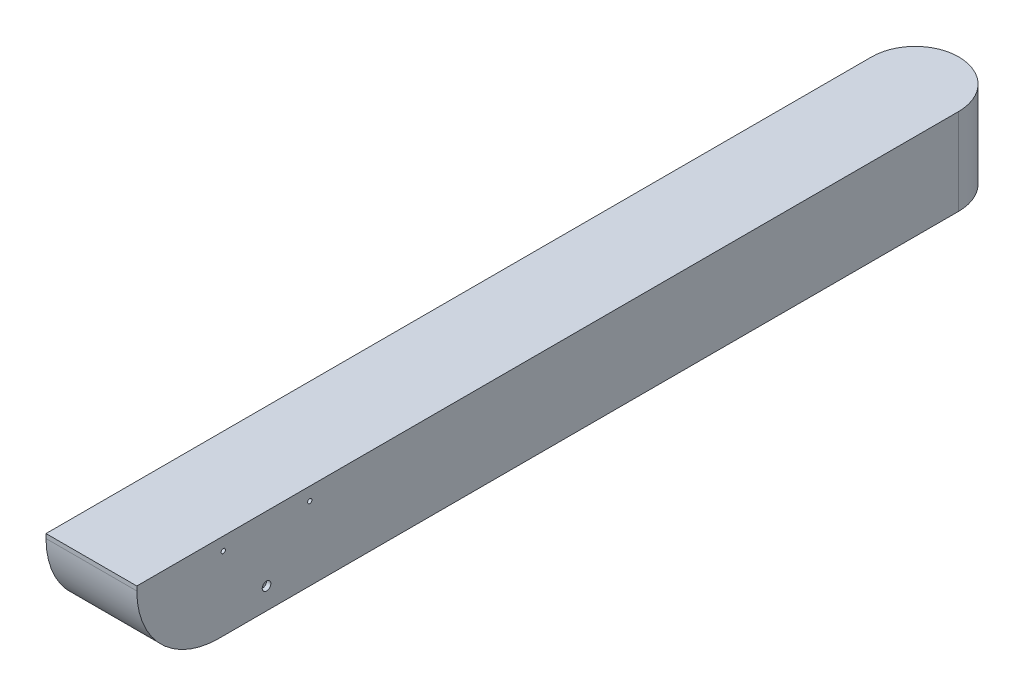
from build123d import *

# Parameters (mm, degrees)
SKETCH1_W           = 210
SKETCH1_H           = 2010
BOSS_EXTRUDE1_DEPTH = 200
FILLET1_R           = 110
FILLET2_R           = 100
FILLET3_R           = 190
SKETCH3_R           = 10
CUT_EXTRUDE1_DEPTH  = 10
SKETCH4_R           = 5
CUT_EXTRUDE2_DEPTH  = 2031.812645224


with BuildPart() as part:
    # Sketch1 → Boss-Extrude1 (new body)
    with BuildSketch(Plane(origin=(0, 0, 0), x_dir=(1, 0, 0), z_dir=(0, 1, 0))):
        with Locations((105, -1005)):
            Rectangle(SKETCH1_W, SKETCH1_H)
    extrude(amount=BOSS_EXTRUDE1_DEPTH)

    # Fillet1
    fillet1_edges = [part.edges().sort_by_distance(p)[0] for p in [
        (210, 100, 0),
    ]]
    fillet(fillet1_edges, radius=FILLET1_R)

    # Fillet2
    fillet2_edges = [part.edges().sort_by_distance(p)[0] for p in [
        (0, 100, 0),
    ]]
    fillet(fillet2_edges, radius=FILLET2_R - 0.0001)  # a hair under: the kernel refuses the full size

    # Fillet3
    fillet3_edges = [part.edges().sort_by_distance(p)[0] for p in [
        (105, 0, 2010),
    ]]
    fillet(fillet3_edges, radius=FILLET3_R)

    # Sketch3 → Cut-Extrude1 (cut)
    with BuildSketch(Plane(origin=(210, 0, 0), x_dir=(0, 0, -1), z_dir=(1, 0, 0))):
        with Locations((-1710, 50)):
            Circle(SKETCH3_R)
    extrude(amount=-CUT_EXTRUDE1_DEPTH, mode=Mode.SUBTRACT)

    # Sketch4 → Cut-Extrude2 (cut, through all)
    with BuildSketch(Plane(origin=(210, 0, 0), x_dir=(0, 0, -1), z_dir=(1, 0, 0))):
        with Locations((-1810, 170)):
            Circle(SKETCH4_R)
        with Locations((-1610, 170)):
            Circle(SKETCH4_R)
    extrude(amount=-CUT_EXTRUDE2_DEPTH, mode=Mode.SUBTRACT)


solid = part.part
